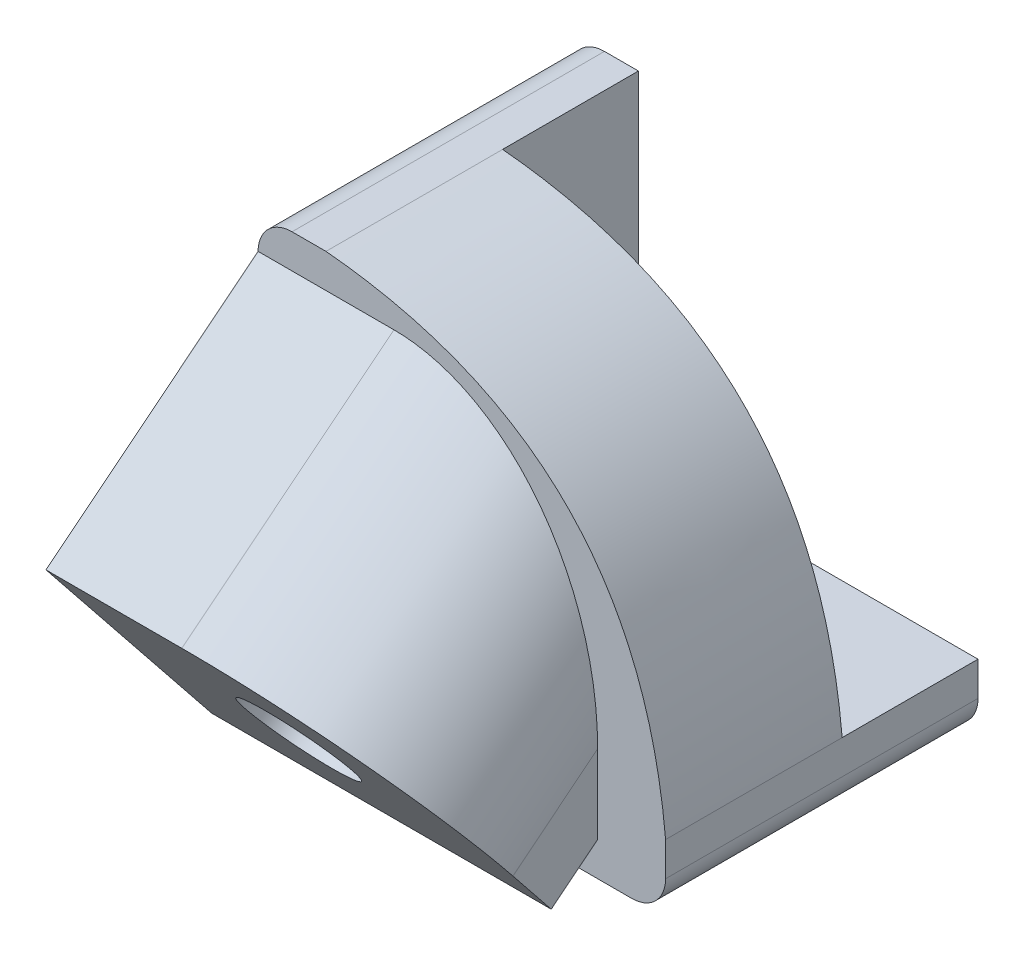
from build123d import *

# Parameters (mm, degrees)
SKETCH1_R                = 3.1115
BOSS_EXTRUDE1_DEPTH      = 3.81
BOSS_EXTRUDE2_DEPTH      = 5.08
BOSS_EXTRUDE2_DEPTH_BACK = 3.81
BOSS_EXTRUDE3_START      = 0.254
BOSS_EXTRUDE3_DEPTH      = 0.254
BOSS_EXTRUDE4_START      = 2.54
BOSS_EXTRUDE4_DEPTH      = 2.54
BOSS_EXTRUDE5_DEPTH      = 12.7
FILLET1_R                = 7.62
SKETCH11_R               = 2.000000064
CUT_EXTRUDE1_DEPTH       = 6.99999997


with BuildPart() as part:
    # Sketch1 → Boss-Extrude1 (new body)
    with BuildSketch(Plane.XY):
        with BuildLine():
            Line((0, 0), (12.7, 0))
            add(Edge.make_bspline(
                [(0, 12.7), (11.620302725, 11.620302725), (12.7, 0)],
                knots=[0, 0, 0, 1, 1, 1], degree=2))
            Line((0, 12.7), (0, 0))
        make_face()
        with Locations(Location((5.08, 5.08, 0), (0, 0, 180))):
            Circle(SKETCH1_R, mode=Mode.SUBTRACT)
    extrude(amount=BOSS_EXTRUDE1_DEPTH)

    # Sketch2 → Boss-Extrude2 (add, two sides: drawn at the far end of the back side and taken through both)
    with BuildSketch(Plane(origin=(0, 0, 0), x_dir=(-1, 0, 0), z_dir=(0, 0, -1)).offset(-BOSS_EXTRUDE2_DEPTH_BACK)):
        with BuildLine():
            Line((0, 12.7), (1.27, 12.7))
            ThreePointArc((1.27, 12.7), (2.168025612, 12.328025612), (2.54, 11.43))
            Line((2.54, 11.43), (2.54, -1.27))
            ThreePointArc((2.54, -1.27), (2.168025612, -2.168025612), (1.27, -2.54))
            Line((1.27, -2.54), (-11.43, -2.54))
            ThreePointArc((-11.43, -2.54), (-12.328025612, -2.168025612), (-12.7, -1.27))
            Line((-12.7, -1.27), (-12.7, 0))
            Line((-12.7, 0), (0, 0))
            Line((0, 0), (0, 12.7))
        make_face()
    extrude(amount=BOSS_EXTRUDE2_DEPTH + BOSS_EXTRUDE2_DEPTH_BACK)

    # Sketch3 → Boss-Extrude3 (add)
    with BuildSketch(Plane.XY.offset(3.81).offset(BOSS_EXTRUDE3_START)):
        with BuildLine():
            Line((-2.54, 11.43), (-2.54, -1.27))
            ThreePointArc((-2.54, -1.27), (-2.168025612, -2.168025612), (-1.27, -2.54))
            Line((-1.27, -2.54), (11.43, -2.54))
            ThreePointArc((11.43, -2.54), (12.328025612, -2.168025612), (12.7, -1.27))
            Line((12.7, -1.27), (12.7, 0))
            add(Edge.make_bspline(
                [(0, 12.7), (11.620302725, 11.620302725), (12.7, 0)],
                knots=[0, 0, 0, 1, 1, 1], degree=2))
            Line((0, 12.7), (-1.27, 12.7))
            ThreePointArc((-1.27, 12.7), (-2.168025612, 12.328025612), (-2.54, 11.43))
        make_face()
    extrude(amount=-BOSS_EXTRUDE3_DEPTH)

    # Sketch4 → Boss-Extrude4 (add)
    with BuildSketch(Plane.XY.offset(4.064).offset(BOSS_EXTRUDE4_START)):
        with BuildLine():
            Line((-2.54, 11.43), (-2.54, -1.27))
            ThreePointArc((-2.54, -1.27), (-2.168025612, -2.168025612), (-1.27, -2.54))
            Line((-1.27, -2.54), (11.43, -2.54))
            ThreePointArc((11.43, -2.54), (12.328025612, -2.168025612), (12.7, -1.27))
            Line((12.7, -1.27), (12.7, 0))
            add(Edge.make_bspline(
                [(0, 12.7), (11.620302725, 11.620302725), (12.7, 0)],
                knots=[0, 0, 0, 1, 1, 1], degree=2))
            Line((0, 12.7), (-1.27, 12.7))
            ThreePointArc((-1.27, 12.7), (-2.168025612, 12.328025612), (-2.54, 11.43))
        make_face()
    extrude(amount=-BOSS_EXTRUDE4_DEPTH)

    # Sketch10 → Boss-Extrude5 (add)
    with BuildSketch(Plane.ZY.offset(2.54)):
        Polygon((6.604, 11.43), (14.535389884, 5.080302802), (8.339287015, -2.659232815), (6.604, -1.27), align=None)
    extrude(amount=-BOSS_EXTRUDE5_DEPTH)

    # Fillet1
    # the kernel refuses this fillet: 7.62 mm, written as the material it takes off along each edge
    with BuildSketch(Plane(origin=(10.16, 23.335682246, -8.267356033), x_dir=(0, -0.7806486106469015, -0.6249701966454579), z_dir=(0, -0.6249701966454579, 0.7806486106469016))) as fillet1_piece_1_section:
        with BuildLine():
            CenterArc((FILLET1_R, -FILLET1_R), FILLET1_R, 90, 90)
            Line((0, -FILLET1_R), (0, 0))
            Line((0, 0), (FILLET1_R, 0))
        make_face()
    fillet1_piece_1 = extrude(amount=48.26, mode=Mode.PRIVATE)
    fillet1_piece_1 = split(fillet1_piece_1, bisect_by=Plane(origin=(9.16105253, 9.619488642, 6.604), z_dir=(0, 0, 1)), keep=Keep.TOP, mode=Mode.PRIVATE)
    add(fillet1_piece_1, mode=Mode.SUBTRACT)

    # Sketch11 → Cut-Extrude1 (cut)
    with BuildSketch(Plane(origin=(0, -5.107252745, 6.379455822), x_dir=(1, 0, 0), z_dir=(0, -0.6249701966454576, 0.7806486106469017))):
        with Locations(Location((3.81, 8.092998121, 0), (0, 0, 270))):
            Circle(SKETCH11_R)
    extrude(amount=-CUT_EXTRUDE1_DEPTH, mode=Mode.SUBTRACT)


solid = part.part
